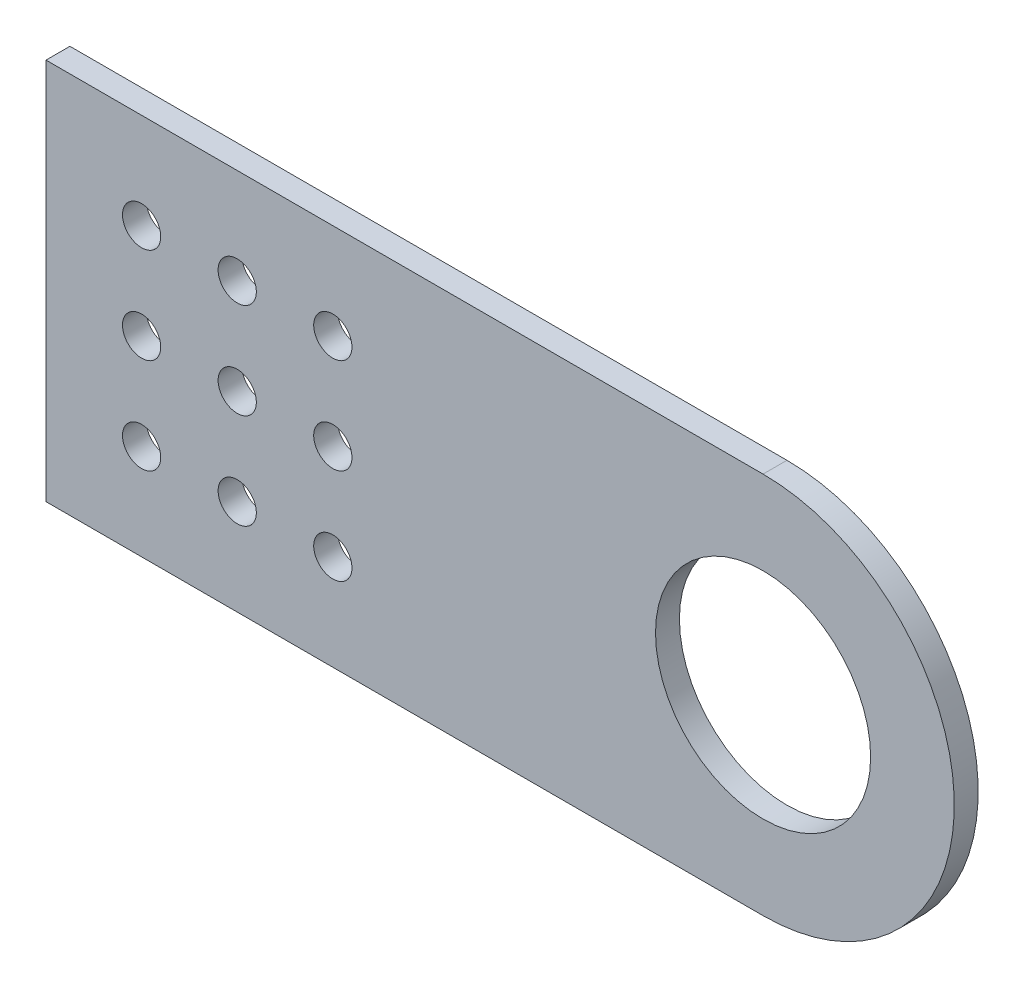
from build123d import *

# Parameters (mm, degrees)
SKETCH1_R           = 2.54
SKETCH1_R_2         = 14.2875
BOSS_EXTRUDE1_DEPTH = 3.175


with BuildPart() as part:
    # Sketch1 → Boss-Extrude1 (new body)
    with BuildSketch(Plane.XY):
        with BuildLine():
            Line((0, 0), (0, 50.8))
            Line((0, 50.8), (95.25, 50.8))
            ThreePointArc((95.25, 50.8), (120.65, 25.4), (95.25, 0))
            Line((95.25, 0), (0, 0))
        make_face()
        with Locations((12.7, 38.1)):
            Circle(SKETCH1_R, mode=Mode.SUBTRACT)
        with Locations((25.4, 38.1)):
            Circle(SKETCH1_R, mode=Mode.SUBTRACT)
        with Locations((38.1, 38.1)):
            Circle(SKETCH1_R, mode=Mode.SUBTRACT)
        with Locations((25.4, 25.4)):
            Circle(SKETCH1_R, mode=Mode.SUBTRACT)
        with Locations((38.1, 25.4)):
            Circle(SKETCH1_R, mode=Mode.SUBTRACT)
        with Locations((25.4, 12.7)):
            Circle(SKETCH1_R, mode=Mode.SUBTRACT)
        with Locations((38.1, 12.7)):
            Circle(SKETCH1_R, mode=Mode.SUBTRACT)
        with Locations((12.7, 25.4)):
            Circle(SKETCH1_R, mode=Mode.SUBTRACT)
        with Locations((12.7, 12.7)):
            Circle(SKETCH1_R, mode=Mode.SUBTRACT)
        with Locations((95.25, 25.4)):
            Circle(SKETCH1_R_2, mode=Mode.SUBTRACT)
    extrude(amount=BOSS_EXTRUDE1_DEPTH)


solid = part.part
